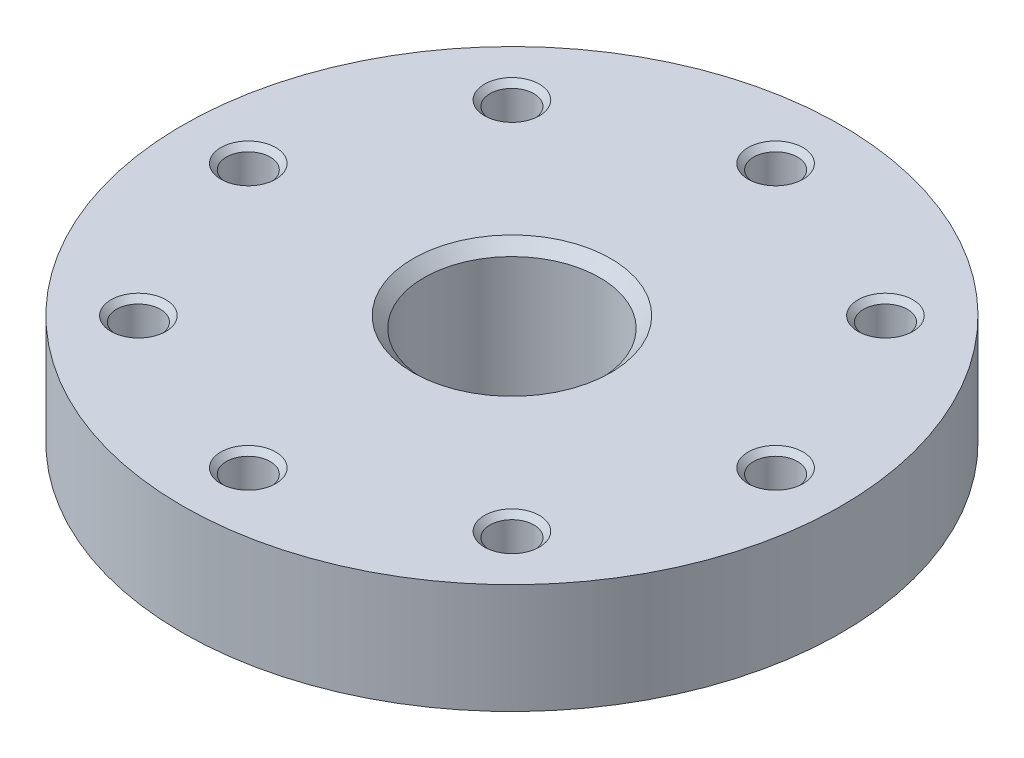
from build123d import *

# Parameters (mm, degrees)
SKETCH1_R           = 15
BOSS_EXTRUDE1_DEPTH = 5
SKETCH2_R           = 1
CUT_EXTRUDE1_DEPTH  = 22.794494718
SKETCH3_R           = 6
BOSS_EXTRUDE2_DEPTH = 1.5
SKETCH4_R           = 1.5
CUT_EXTRUDE2_DEPTH  = 1.5
CHAMFER5_SIZE       = 0.25
SKETCH5_R           = 4
CUT_EXTRUDE3_DEPTH  = 6
CHAMFER7_SIZE       = 0.5


with BuildPart() as part:
    # Sketch1 → Boss-Extrude1 (new body)
    with BuildSketch(Plane(origin=(0, 0, 0), x_dir=(1, 0, 0), z_dir=(0, 1, 0))):
        Circle(SKETCH1_R)
    extrude(amount=BOSS_EXTRUDE1_DEPTH)

    # Sketch2 → Cut-Extrude1 (cut, through all)
    with BuildSketch(Plane(origin=(0, 5, 0), x_dir=(1, 0, 0), z_dir=(0, 1, 0))):
        with Locations((0, 12)):
            Circle(SKETCH2_R)
        with Locations((-12, 0)):
            Circle(SKETCH2_R)
        with Locations((0, -12)):
            Circle(SKETCH2_R)
        with Locations((12, 0)):
            Circle(SKETCH2_R)
        with Locations((-8.5, 8.5)):
            Circle(SKETCH2_R)
        with Locations((-8.5, -8.5)):
            Circle(SKETCH2_R)
        with Locations((8.5, 8.5)):
            Circle(SKETCH2_R)
        with Locations((8.5, -8.5)):
            Circle(SKETCH2_R)
    extrude(amount=-CUT_EXTRUDE1_DEPTH, mode=Mode.SUBTRACT)

    # Sketch3 → Boss-Extrude2 (add)
    with BuildSketch(Plane(origin=(0, 0, 0), x_dir=(1, 0, 0), z_dir=(0, 1, 0))):
        Circle(SKETCH3_R)
    extrude(amount=-BOSS_EXTRUDE2_DEPTH)

    # Sketch4 → Cut-Extrude2 (cut)
    with BuildSketch(Plane.XZ.offset(1.5)):
        Circle(SKETCH4_R)
    extrude(amount=-CUT_EXTRUDE2_DEPTH, mode=Mode.SUBTRACT)

    # Chamfer5
    chamfer5_edges = [part.edges().sort_by_distance(p)[0] for p in [
        (-13, 0, 0),
        (-9.5, 0, -8.5),
        (-1, 0, -12),
        (7.5, 0, -8.5),
        (11, 0, 0),
        (7.5, 0, 8.5),
        (-1, 0, 12),
        (-9.5, 0, 8.5),
        (7.5, 5, -8.5),
        (-1, 5, -12),
        (-9.5, 5, -8.5),
        (-13, 5, 0),
        (-9.5, 5, 8.5),
        (-1, 5, 12),
        (7.5, 5, 8.5),
        (11, 5, 0),
    ]]
    chamfer(chamfer5_edges, length=CHAMFER5_SIZE)

    # Sketch5 → Cut-Extrude3 (cut)
    with BuildSketch(Plane(origin=(0, 5, 0), x_dir=(1, 0, 0), z_dir=(0, 1, 0))):
        Circle(SKETCH5_R)
    extrude(amount=-CUT_EXTRUDE3_DEPTH, mode=Mode.SUBTRACT)

    # Chamfer7
    chamfer7_edges = [part.edges().sort_by_distance(p)[0] for p in [
        (-4, 5, 0),
    ]]
    chamfer(chamfer7_edges, length=CHAMFER7_SIZE)


solid = part.part
